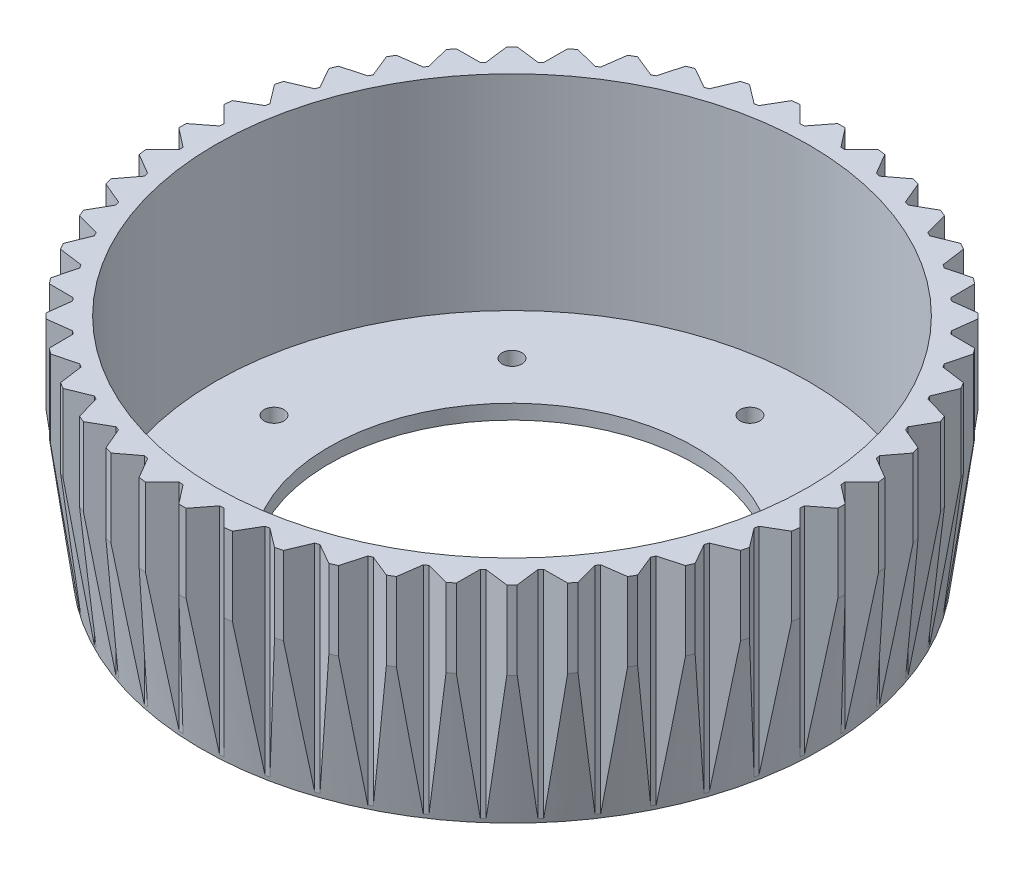
from build123d import *

# Parameters (mm, degrees)
SKETCH1_R              = 42.5
SKETCH1_R_2            = 40.5
MAINBODY_DEPTH         = 30
SINGLETOOTH_DEPTH      = 30
TOOTHPATTERN_COUNT     = 48
SKETCH1_3_R            = 40.5
SKETCH1_3_R_2          = 25
BASE_DEPTH             = 2
SKETCH3_R              = 1.35
BOLTTHROUGHHOLES_DEPTH = 70.526973183


with BuildPart() as part:
    # Sketch1 → MainBody (new body)
    with BuildSketch(Plane(origin=(0, 0, 0), x_dir=(1, 0, 0), z_dir=(0, 1, 0))):
        with Locations(Location((0, 0, 0), (0, 0, 270))):
            Circle(SKETCH1_R)
        with Locations(Location((0, 0, 0), (0, 0, 270))):
            Circle(SKETCH1_R_2, mode=Mode.SUBTRACT)
    extrude(amount=MAINBODY_DEPTH)

    # Sketch2 → SingleTooth (add)
    with BuildSketch(Plane(origin=(0, 30, 0), x_dir=(1, 0, 0), z_dir=(0, 1, 0))):
        Polygon((-0.5, 45), (-2.5, 42.426406871), (2.5, 42.426406871), (0.5, 45), (0, 45), align=None)
    singletooth = extrude(amount=-SINGLETOOTH_DEPTH)

    # ToothPattern: SingleTooth ×48 about axis
    toothpattern_axis = Axis((0, 0, 0), (0, 1, 0))
    for i in range(1, TOOTHPATTERN_COUNT):
        add(singletooth.rotate(toothpattern_axis, i * 360 / TOOTHPATTERN_COUNT))

    # Sketch1<3> → Base (add)
    with BuildSketch(Plane(origin=(0, 0, 0), x_dir=(1, 0, 0), z_dir=(0, 1, 0))):
        with Locations(Location((0, 0, 0), (0, 0, 270))):
            Circle(SKETCH1_3_R)
        with Locations(Location((0, 0, 0), (0, 0, 270))):
            Circle(SKETCH1_3_R_2, mode=Mode.SUBTRACT)
    extrude(amount=BASE_DEPTH)

    # Sketch3 → BoltThroughHoles (cut, through all)
    with BuildSketch(Plane(origin=(0, 2, 0), x_dir=(1, 0, 0), z_dir=(0, 1, 0))):
        with Locations(Location((0, 32.5, 0), (0, 0, 270))):
            Circle(SKETCH3_R)
        with Locations(Location((22.980970389, 22.980970389, 0), (0, 0, 270))):
            Circle(SKETCH3_R)
        with Locations(Location((32.5, 0, 0), (0, 0, 270))):
            Circle(SKETCH3_R)
        with Locations(Location((22.980970389, -22.980970389, 0), (0, 0, 270))):
            Circle(SKETCH3_R)
        with Locations(Location((0, -32.5, 0), (0, 0, 270))):
            Circle(SKETCH3_R)
        with Locations(Location((-22.980970389, -22.980970389, 0), (0, 0, 270))):
            Circle(SKETCH3_R)
        with Locations(Location((-32.5, 0, 0), (0, 0, 270))):
            Circle(SKETCH3_R)
        with Locations(Location((-22.980970389, 22.980970389, 0), (0, 0, 270))):
            Circle(SKETCH3_R)
    extrude(amount=-BOLTTHROUGHHOLES_DEPTH, mode=Mode.SUBTRACT)

    # Sketch5 → TeethTaper (revolve, cut)
    with BuildSketch(Plane(origin=(0, 0, -5.329587106), x_dir=(0, 0, 1), z_dir=(-1, 0, 0)), mode=Mode.PRIVATE) as teethtaper_sk:
        Polygon((-39.670412894, 0), (-37.096819765, 0), (-39.670412894, 19.30285108), align=None)
        Polygon((-39.670412894, 19.30285108), (-42.170412894, 38.053727884), (-42.170412894, 32.263024916), (-42.170412894, -5), (-39.350214406, -5), (-37.096819765, 0), (-39.670412894, 0), align=None)
    revolve(teethtaper_sk.sketch.rotate(Axis((0, 0, 0), (0, 1, 0)), 179.363406542), axis=Axis((0, 0, 0), (0, 1, 0)), mode=Mode.SUBTRACT)


solid = part.part
